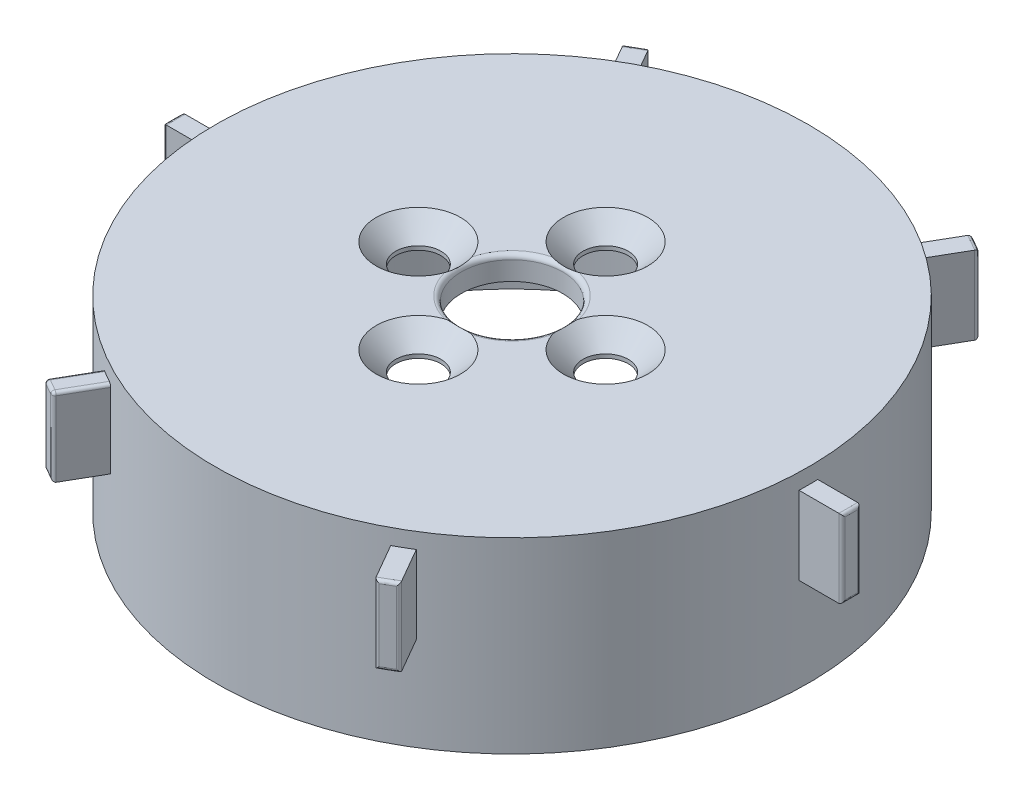
from build123d import *

# Parameters (mm, degrees)
HOLE_WIZARD_0_D           = 2.9
HOLE_WIZARD_0_CSINK_D     = 5.4
HOLE_WIZARD_0_CSINK_ANGLE = 90
EXTRUDE_START             = -6
EXTRUDE_3_DEPTH           = 5
CUT_EXTRUDE_START         = -6
SKETCH_10_OUTSIDE_W       = 65.522
SKETCH_10_OUTSIDE_H       = 59.424
SKETCH_10_OUTSIDE_R       = 21.75
CUT_EXTRUDE_1_DEPTH       = 5
FILLET_2_R                = 0.2
FILLET_3_R                = 0.3


with BuildPart() as part:
    # 草图2 → 旋转1 (revolve)
    with BuildSketch(Plane.XY, mode=Mode.PRIVATE) as revolve_1_sk:
        Polygon((-17.5, 0), (-17.5, 10.5), (-3.25, 10.5), (-3.25, 12), (-19, 12), (-19, 0), align=None)
    revolve(revolve_1_sk.sketch.rotate(Axis((0, 0, 0), (0, 1, 0)), 270), axis=Axis((0, 0, 0), (0, 1, 0)))

    # 打孔尺寸(%根据十字)槽半沉头木螺钉的类型0 (through all)
    with Locations(Plane(origin=(0, 12, 0), x_dir=(1, 0, 0), z_dir=(0, 1, 0))):
        with Locations((-6, 0), (0, 6), (6, 0), (0, -6)):
            CounterSinkHole(HOLE_WIZARD_0_D / 2, HOLE_WIZARD_0_CSINK_D / 2, counter_sink_angle=HOLE_WIZARD_0_CSINK_ANGLE)

    # 草图9 → 凸台-拉伸3 (add)
    with BuildSketch(Plane(origin=(0, 12, 0), x_dir=(1, 0, 0), z_dir=(0, 1, 0)).offset(EXTRUDE_START)):
        with BuildLine():
            ThreePointArc((-18.990523953, -0.6), (-19, 0), (-18.990523953, 0.6))
            Line((-18.990523953, 0.6), (-25, 0.6))
            Line((-25, 0.6), (-25, -0.6))
            Line((-25, -0.6), (-18.990523953, -0.6))
        make_face()
        with BuildLine():
            Line((-13.019615242, 21.350635095), (-10.014877219, 16.146276174))
            ThreePointArc((-10.014877219, 16.146276174), (-9.5, 16.454482672), (-8.975646734, 16.746276174))
            Line((-8.975646734, 16.746276174), (-11.980384758, 21.950635095))
            Line((-11.980384758, 21.950635095), (-13.019615242, 21.350635095))
        make_face()
        with BuildLine():
            ThreePointArc((-8.975646734, -16.746276174), (-9.5, -16.454482672), (-10.014877219, -16.146276174))
            Line((-10.014877219, -16.146276174), (-13.019615242, -21.350635095))
            Line((-13.019615242, -21.350635095), (-11.980384758, -21.950635095))
            Line((-11.980384758, -21.950635095), (-8.975646734, -16.746276174))
        make_face()
        with BuildLine():
            Line((11.980384758, 21.950635095), (8.975646734, 16.746276174))
            ThreePointArc((8.975646734, 16.746276174), (9.5, 16.454482672), (10.014877219, 16.146276174))
            Line((10.014877219, 16.146276174), (13.019615242, 21.350635095))
            Line((13.019615242, 21.350635095), (11.980384758, 21.950635095))
        make_face()
        with BuildLine():
            ThreePointArc((10.014877219, -16.146276174), (9.5, -16.454482672), (8.975646734, -16.746276174))
            Line((8.975646734, -16.746276174), (11.980384758, -21.950635095))
            Line((11.980384758, -21.950635095), (13.019615242, -21.350635095))
            Line((13.019615242, -21.350635095), (10.014877219, -16.146276174))
        make_face()
        with BuildLine():
            Line((25, 0.6), (18.990523953, 0.6))
            ThreePointArc((18.990523953, 0.6), (19, 0), (18.990523953, -0.6))
            Line((18.990523953, -0.6), (25, -0.6))
            Line((25, -0.6), (25, 0.6))
        make_face()
    extrude(amount=EXTRUDE_3_DEPTH)

    # 草图10 outside → 切除-拉伸1 (cut)
    with BuildSketch(Plane(origin=(0, 12, 0), x_dir=(1, 0, 0), z_dir=(0, 1, 0)).offset(CUT_EXTRUDE_START)):
        Rectangle(SKETCH_10_OUTSIDE_W, SKETCH_10_OUTSIDE_H)
        Circle(SKETCH_10_OUTSIDE_R, mode=Mode.SUBTRACT)
    extrude(amount=CUT_EXTRUDE_1_DEPTH, mode=Mode.SUBTRACT)

    # 圆角2
    fillet_2_edges = [part.edges().sort_by_distance(p)[0] for p in [
        (-10.351246039, 8.5, 19.128884061),
        (-11.390476524, 8.5, 18.528884061),
        (-21.741722563, 8.5, -0.6),
        (-21.741722563, 8.5, 0.6),
        (-10.351246039, 8.5, -19.128884061),
        (-11.390476524, 8.5, -18.528884061),
        (11.390476524, 8.5, -18.528884061),
        (10.351246039, 8.5, -19.128884061),
        (21.741722563, 8.5, -0.6),
        (21.741722563, 8.5, 0.6),
        (11.390476524, 8.5, 18.528884061),
        (10.351246039, 8.5, 19.128884061),
        (-10.875, 6, 18.836052532),
        (-21.75, 6, 0),
        (-21.75, 11, 0),
        (-10.875, 6, -18.836052532),
        (10.875, 6, -18.836052532),
        (21.75, 6, 0),
        (10.875, 6, 18.836052532),
        (-10.702676871, 11, 17.337580118),
        (-9.663446387, 11, 17.937580118),
        (-10.875, 11, 18.836052532),
        (-10.875, 11, -18.836052532),
        (10.875, 11, -18.836052532),
        (21.75, 11, 0),
        (10.875, 11, 18.836052532),
    ]]
    fillet(fillet_2_edges, radius=FILLET_2_R)

    # 圆角3
    # the kernel refuses this fillet: 0.3 mm, written as the material it takes off along each edge
    with BuildSketch(Plane(origin=(0, 12, 0), x_dir=(0, 0, -1), z_dir=(1, 0, 0))) as fillet_3_piece_1:
        with BuildLine():
            CenterArc((3.25 + FILLET_3_R, -FILLET_3_R), FILLET_3_R, 90, 90)
            Line((3.25, -FILLET_3_R), (3.25, 0))
            Line((3.25, 0), (3.25 + FILLET_3_R, 0))
        make_face()
    revolve(axis=Axis((0, 12, 0), (0, 1, 0)), mode=Mode.SUBTRACT)


solid = part.part
